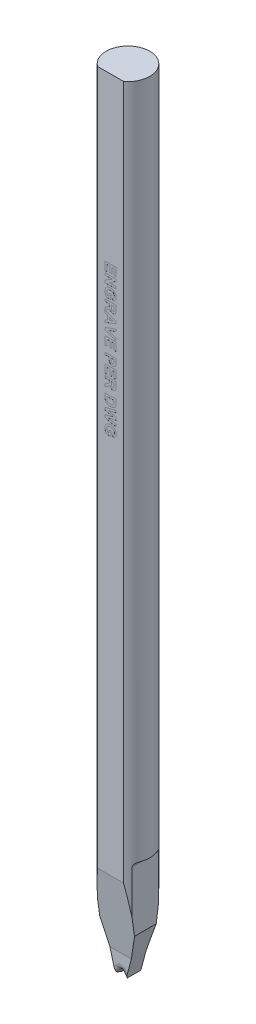
from build123d import *

# Parameters (mm, degrees)
SKETCH_TL_CUTTING_R       = 1.99771
TL_CUTTING_DEPTH          = 72.009
SKETCH_TDF_GRINDING_W     = 4.01542
SKETCH_TDF_GRINDING_H     = 4.01542
TDF_GRINDING_DEPTH        = 73.064400167
ENGRAVING_DEPTH           = 0.005
VW_VR_GRINDING_DEPTH      = 2.00771
VW_VR_GRINDING_DEPTH_BACK = 2.00771
ISA_GRINDING_DEPTH        = 2.00771
ISA_GRINDING_DEPTH_BACK   = 2.00771
PRE_FRX_BRX_DEPTH         = 2.00771
PRE_FRX_BRX_DEPTH_BACK    = 2.00771
SKETCH_PRE_FRX_BRX_W      = 1.33334
SKETCH_PRE_FRX_BRX_H      = 1.80086
FR_EDM_R                  = 0.50038
BR_EDM_R                  = 0.24892
FA_BA_GRINDING_DEPTH      = 2.00771
FA_BA_GRINDING_DEPTH_BACK = 2.00771


with BuildPart() as part:
    # sketch_TL_cutting → TL_cutting (new body)
    with BuildSketch(Plane(origin=(0, 0, 0), x_dir=(1, 0, 0), z_dir=(0, 1, 0))):
        Circle(SKETCH_TL_CUTTING_R)
    extrude(amount=TL_CUTTING_DEPTH)

    # sketch_TDF_grinding → TDF_grinding (cut, through all)
    with BuildSketch(Plane(origin=(0, 0, 0), x_dir=(1, 0, 0), z_dir=(0, 1, 0))):
        with Locations((0, -3.60918)):
            Rectangle(SKETCH_TDF_GRINDING_W, SKETCH_TDF_GRINDING_H)
    extrude(amount=TDF_GRINDING_DEPTH, mode=Mode.SUBTRACT)

    # sketch_engraving → engraving (cut)
    # profile 1 of 13: a face of its own
    with BuildSketch(Plane.XY.offset(1.60147)):
        Polygon((-0.5, 56.906435897), (0.5, 56.906435897), (0.5, 56.162846154), (0.333333333, 56.162846154), (0.333333333, 56.714128205), (0.115384615, 56.714128205), (0.115384615, 56.201307692), (-0.051282051, 56.201307692), (-0.051282051, 56.714128205), (-0.333333333, 56.714128205), (-0.333333333, 56.150025641), (-0.5, 56.150025641), align=None)
    # profile 2 of 13: a face of its own
    with BuildSketch(Plane.XY.offset(1.60147)):
        Polygon((-0.5, 55.983358974), (0.5, 55.983358974), (0.5, 55.7824375), (-0.157451923, 55.380794872), (0.5, 55.380794872), (0.5, 55.188487179), (-0.5, 55.188487179), (-0.5, 55.39561859), (0.147035256, 55.791051282), (-0.5, 55.791051282), align=None)
    # profile 3 of 13: a face of its own
    with BuildSketch(Plane.XY.offset(1.60147)):
        with BuildLine():
            Line((-0.128205128, 54.534641026), (0.038461538, 54.534641026))
            Line((0.038461538, 54.534641026), (0.038461538, 54.09874359))
            Line((0.038461538, 54.09874359), (-0.36338141, 54.09874359))
            add(Edge.make_bspline(
                [(-0.36338141, 54.09874359), (-0.368321434, 54.104229605), (-0.378419843, 54.115444131), (-0.392661125, 54.133741895), (-0.406257259, 54.15388601), (-0.4194836, 54.1757547), (-0.432233696, 54.199393223), (-0.444685123, 54.224707295), (-0.45671611, 54.251743622), (-0.471787381, 54.289976941), (-0.488186169, 54.339191061), (-0.502445448, 54.399356306), (-0.511191227, 54.459997498), (-0.512277771, 54.500558306), (-0.512820513, 54.52081891)],
                knots=[0, 0, 0, 0, 0.581799769, 1.189316438, 1.825828404, 2.496525428, 3.203088405, 3.942228803, 4.719818701, 5.534979611, 7.181138583, 8.803804008, 10.403462225, 12, 12, 12, 12], degree=3))
            add(Edge.make_bspline(
                [(-0.512820513, 54.52081891), (-0.512629241, 54.533511396), (-0.512252188, 54.558532062), (-0.509233571, 54.595470349), (-0.504017902, 54.631187455), (-0.496780719, 54.665619967), (-0.487836372, 54.698870877), (-0.476607913, 54.730823396), (-0.463065488, 54.761443299), (-0.447986133, 54.790959812), (-0.430657849, 54.818812408), (-0.411724289, 54.845056254), (-0.390891397, 54.869436635), (-0.36853351, 54.892165448), (-0.344060025, 54.912814033), (-0.318106216, 54.931895872), (-0.290219674, 54.948954268), (-0.260879177, 54.96428079), (-0.230317098, 54.977910173), (-0.198781008, 54.989412477), (-0.166726875, 54.999496153), (-0.134042675, 55.007783938), (-0.10062201, 55.013870885), (-0.066619552, 55.01860276), (-0.031822841, 55.021144234), (-0.008417054, 55.021593556), (0.003405449, 55.021820513)],
                knots=[0, 0, 0, 0, 1.124897971, 2.217508473, 3.282174662, 4.322209414, 5.334422951, 6.332119154, 7.320662553, 8.300074908, 9.267468154, 10.225199689, 11.165658754, 12.107290334, 13.047749399, 14.00069605, 14.959944213, 15.942088746, 16.933021067, 17.923599838, 18.915715637, 19.910475908, 20.909926025, 21.925232038, 22.952013513, 24, 24, 24, 24], degree=3))
            add(Edge.make_bspline(
                [(0.003405449, 55.021820513), (0.016165747, 55.021636614), (0.041321811, 55.021274069), (0.078501182, 55.018144425), (0.114594914, 55.01329647), (0.149519517, 55.005901478), (0.183523729, 54.997048027), (0.216299841, 54.985703339), (0.248180515, 54.972749892), (0.278688999, 54.957465774), (0.308028284, 54.940583202), (0.335510174, 54.921399631), (0.361403632, 54.90058003), (0.385591047, 54.877937199), (0.407627145, 54.853098237), (0.428063784, 54.826572539), (0.447146094, 54.79837769), (0.457908016, 54.778200967), (0.463341346, 54.768014423)],
                knots=[0, 0, 0, 0, 1.105132952, 2.178694671, 3.229818344, 4.257558797, 5.269123684, 6.27148554, 7.259679084, 8.247804916, 9.224967877, 10.189258471, 11.147685264, 12.101072275, 13.055511435, 14.02039165, 15.000562851, 16, 16, 16, 16], degree=3))
            add(Edge.make_bspline(
                [(0.463341346, 54.768014423), (0.467347168, 54.759927072), (0.475455657, 54.743556849), (0.485329628, 54.717483756), (0.494054347, 54.690116179), (0.500719187, 54.661134703), (0.506115234, 54.630848224), (0.510216979, 54.599107147), (0.512307439, 54.565852939), (0.512647258, 54.543190515), (0.512820513, 54.531636218)],
                knots=[0, 0, 0, 0, 0.887950456, 1.797368171, 2.741221183, 3.713797788, 4.722103116, 5.768966405, 6.862521341, 8, 8, 8, 8], degree=3))
            add(Edge.make_bspline(
                [(0.512820513, 54.531636218), (0.512598613, 54.516738718), (0.512167059, 54.487765835), (0.508571106, 54.445525541), (0.502373597, 54.405771904), (0.493837942, 54.368449565), (0.482863355, 54.333638928), (0.469371425, 54.301399918), (0.453633675, 54.27153466), (0.435019378, 54.244475716), (0.414494937, 54.219673149), (0.392035387, 54.19719168), (0.367607461, 54.177022262), (0.341334074, 54.159151549), (0.313106625, 54.143720198), (0.283182558, 54.130452182), (0.251334696, 54.119531), (0.22921692, 54.114253034), (0.217948718, 54.111564103)],
                knots=[0, 0, 0, 0, 1.271135529, 2.472123572, 3.614091059, 4.701890498, 5.736279567, 6.724681829, 7.680621489, 8.611506429, 9.52200816, 10.424540711, 11.318996785, 12.221421405, 13.131851814, 14.060431888, 15.011860567, 16, 16, 16, 16], degree=3))
            Line((0.217948718, 54.111564103), (0.179487179, 54.303871795))
            add(Edge.make_bspline(
                [(0.179487179, 54.303871795), (0.185798707, 54.305774377), (0.198251232, 54.309528136), (0.216108293, 54.316834712), (0.232994438, 54.325152834), (0.248643132, 54.334979827), (0.263649233, 54.345417482), (0.277161531, 54.357687665), (0.290187329, 54.370594684), (0.301701762, 54.38508584), (0.312086782, 54.400524395), (0.321450083, 54.416745863), (0.329043783, 54.434114205), (0.335153652, 54.452386828), (0.340342569, 54.471474233), (0.343533767, 54.491625571), (0.345940549, 54.51261453), (0.346081986, 54.526954556), (0.346153846, 54.534240385)],
                knots=[0, 0, 0, 0, 1.027780279, 2.027791312, 3.006028774, 3.96000864, 4.908113241, 5.852721087, 6.802883308, 7.765918715, 8.733730415, 9.704005314, 10.683351261, 11.68471758, 12.707948499, 13.764514378, 14.864202456, 16, 16, 16, 16], degree=3))
            add(Edge.make_bspline(
                [(0.346153846, 54.534240385), (0.345859633, 54.545267741), (0.34528545, 54.566788568), (0.341538784, 54.598206107), (0.334873123, 54.627845672), (0.325679114, 54.65578477), (0.313877959, 54.682074621), (0.299029501, 54.706359968), (0.282012344, 54.729245501), (0.262039987, 54.750079978), (0.239645267, 54.768974481), (0.214561065, 54.785331053), (0.186868462, 54.79894783), (0.156706511, 54.810100746), (0.124073954, 54.818980847), (0.088855272, 54.825004995), (0.051104495, 54.828941063), (0.02505068, 54.829318323), (0.01161859, 54.829512821)],
                knots=[0, 0, 0, 0, 1.043810997, 2.037086103, 2.989314757, 3.91471467, 4.817033861, 5.710208705, 6.603920097, 7.511448416, 8.435617211, 9.371747005, 10.338444094, 11.350425613, 12.411431869, 13.5347293, 14.729025275, 16, 16, 16, 16], degree=3))
            add(Edge.make_bspline(
                [(0.01161859, 54.829512821), (-0.002813331, 54.829310147), (-0.03086261, 54.828916238), (-0.071503034, 54.825081337), (-0.109371212, 54.818783116), (-0.14440027, 54.809715757), (-0.176807311, 54.798408494), (-0.206438048, 54.784428966), (-0.233109204, 54.76762113), (-0.256980675, 54.748558295), (-0.278169336, 54.727521484), (-0.296147735, 54.704458524), (-0.31184176, 54.680200317), (-0.32420794, 54.654060517), (-0.33413508, 54.626512028), (-0.341078682, 54.597285999), (-0.345395871, 54.566487729), (-0.345897627, 54.545406176), (-0.346153846, 54.534641026)],
                knots=[0, 0, 0, 0, 1.31821493, 2.562027667, 3.72541598, 4.821825939, 5.863743127, 6.857000185, 7.808227391, 8.737146514, 9.643023621, 10.529087527, 11.404035307, 12.277173472, 13.164790074, 14.074766194, 15.016892606, 16, 16, 16, 16], degree=3))
            add(Edge.make_bspline(
                [(-0.346153846, 54.534641026), (-0.345850315, 54.523737735), (-0.34524035, 54.501826847), (-0.340086045, 54.469005767), (-0.332449955, 54.436005514), (-0.321065283, 54.403613163), (-0.307937779, 54.372226456), (-0.292687307, 54.343060255), (-0.276962331, 54.315667677), (-0.264654274, 54.2991552), (-0.258613782, 54.291051282)],
                knots=[0, 0, 0, 0, 0.993779204, 1.997065276, 3.023588959, 4.078879359, 5.123947549, 6.123456565, 7.079038607, 8, 8, 8, 8], degree=3))
            Line((-0.258613782, 54.291051282), (-0.128205128, 54.291051282))
            Line((-0.128205128, 54.291051282), (-0.128205128, 54.534641026))
        make_face()
    # profile 4 of 13: a face of its own
    with BuildSketch(Plane.XY.offset(1.60147)):
        with BuildLine():
            Line((-0.5, 53.906435897), (0.5, 53.906435897))
            Line((0.5, 53.906435897), (0.5, 53.486764423))
            add(Edge.make_bspline(
                [(0.5, 53.486764423), (0.499921351, 53.474010201), (0.499769781, 53.449430481), (0.498665723, 53.413883268), (0.496349389, 53.381101265), (0.493735057, 53.350936822), (0.489890849, 53.323477094), (0.485377151, 53.298656079), (0.480042652, 53.276553829), (0.473762142, 53.2569266), (0.46640441, 53.239099938), (0.457825047, 53.222435326), (0.447696774, 53.206775272), (0.436444977, 53.191914477), (0.424039539, 53.177795254), (0.410155618, 53.164803274), (0.394999014, 53.152712567), (0.378696089, 53.141532781), (0.361318758, 53.131684096), (0.343425117, 53.122684982), (0.324824746, 53.115359364), (0.305605269, 53.10930847), (0.285808412, 53.104474923), (0.265383845, 53.101120032), (0.244368538, 53.099025611), (0.230173307, 53.098838641), (0.222956731, 53.09874359)],
                knots=[0, 0, 0, 0, 1.675792322, 3.229558513, 4.671612708, 5.993327294, 7.206773438, 8.313218507, 9.306927966, 10.191988363, 11.018030861, 11.838135071, 12.650980327, 13.465150207, 14.285535933, 15.117196726, 15.959844754, 16.83101188, 17.711363548, 18.582398133, 19.460517458, 20.334551361, 21.228266118, 22.135486512, 23.052118027, 24, 24, 24, 24], degree=3))
            add(Edge.make_bspline(
                [(0.222956731, 53.09874359), (0.213865176, 53.09891771), (0.196097772, 53.099257988), (0.170067915, 53.102459374), (0.145135532, 53.107060931), (0.121515047, 53.114174247), (0.099028777, 53.123018829), (0.077834712, 53.133824821), (0.057734109, 53.146577691), (0.039011166, 53.161343067), (0.021628172, 53.178061702), (0.005964946, 53.196827919), (-0.008142217, 53.217517705), (-0.020271369, 53.240300383), (-0.030960543, 53.264783224), (-0.039742833, 53.291288699), (-0.046961528, 53.31968005), (-0.050349413, 53.339434525), (-0.052083333, 53.349544872)],
                knots=[0, 0, 0, 0, 1.059179627, 2.069928931, 3.052909591, 4.01082991, 4.940120368, 5.865982481, 6.779263376, 7.710344595, 8.640547144, 9.585223395, 10.554458868, 11.553878165, 12.589111246, 13.664634927, 14.804759383, 16, 16, 16, 16], degree=3))
            add(Edge.make_bspline(
                [(-0.052083333, 53.349544872), (-0.058543192, 53.339754557), (-0.071157156, 53.320637315), (-0.092244136, 53.294340986), (-0.113935974, 53.270382324), (-0.13350323, 53.252395798), (-0.150629326, 53.238561316), (-0.165615492, 53.227428495), (-0.182859981, 53.215417912), (-0.202374991, 53.20264991), (-0.22398696, 53.188746224), (-0.248026974, 53.174224206), (-0.274260457, 53.158779885), (-0.292585876, 53.148396031), (-0.302083333, 53.143014423)],
                knots=[0, 0, 0, 0, 1.285482994, 2.510122655, 3.691653098, 4.826411195, 5.419869803, 6.105175889, 6.872935239, 7.723789235, 8.662129684, 9.690525463, 10.803075916, 12, 12, 12, 12], degree=3))
            Line((-0.302083333, 53.143014423), (-0.5, 53.021820513))
            Line((-0.5, 53.021820513), (-0.5, 53.246580128))
            Line((-0.5, 53.246580128), (-0.273036859, 53.388807692))
            add(Edge.make_bspline(
                [(-0.273036859, 53.388807692), (-0.263945443, 53.395337401), (-0.24658806, 53.407803957), (-0.221949287, 53.42583509), (-0.199893124, 53.442236608), (-0.1805544, 53.457027372), (-0.163731826, 53.470027709), (-0.149845803, 53.481682343), (-0.138230202, 53.491419639), (-0.126725879, 53.502454127), (-0.114887633, 53.515280533), (-0.103494307, 53.531142305), (-0.094238036, 53.547323543), (-0.087286311, 53.56482809), (-0.082478883, 53.585119627), (-0.079343719, 53.609479092), (-0.077067211, 53.638632144), (-0.076973557, 53.659702303), (-0.076923077, 53.671059295)],
                knots=[0, 0, 0, 0, 1.465382114, 2.797715724, 3.99708711, 5.063614826, 5.985194575, 6.779875669, 7.43696127, 7.968700361, 8.866038685, 9.717629234, 10.520014012, 11.30082289, 12.174340694, 13.242479345, 14.513673363, 16, 16, 16, 16], degree=3))
            Line((-0.076923077, 53.671059295), (-0.076923077, 53.714128205))
            Line((-0.076923077, 53.714128205), (-0.5, 53.714128205))
            Line((-0.5, 53.714128205), (-0.5, 53.906435897))
        make_face()
        with BuildLine():
            Line((0.08974359, 53.714128205), (0.08974359, 53.559280449))
            add(Edge.make_bspline(
                [(0.08974359, 53.559280449), (0.089768957, 53.5473274), (0.089817287, 53.524554821), (0.090527354, 53.492171991), (0.091115821, 53.463309113), (0.09265079, 53.438009153), (0.094114881, 53.416219334), (0.096069001, 53.397967128), (0.09836301, 53.383228848), (0.101931469, 53.368507986), (0.108148092, 53.353428202), (0.117003495, 53.337358518), (0.128487921, 53.323615466), (0.141777239, 53.311742986), (0.157332372, 53.302578485), (0.174706183, 53.295857484), (0.193862841, 53.291843774), (0.20724563, 53.291320802), (0.214142628, 53.291051282)],
                knots=[0, 0, 0, 0, 1.698120923, 3.235207303, 4.601799022, 5.7989489, 6.835765357, 7.704239165, 8.40605236, 8.953649664, 9.852072573, 10.714567413, 11.550246753, 12.383769498, 13.234656382, 14.099651817, 15.020630301, 16, 16, 16, 16], degree=3))
            add(Edge.make_bspline(
                [(0.214142628, 53.291051282), (0.221852989, 53.29138604), (0.236728888, 53.2920319), (0.257822961, 53.297286949), (0.27662771, 53.306034428), (0.292813882, 53.318523618), (0.306623576, 53.33412236), (0.317392842, 53.352846681), (0.325576055, 53.374291747), (0.328565774, 53.389745804), (0.330128205, 53.397822115)],
                knots=[0, 0, 0, 0, 1.062451802, 2.049829439, 2.976851779, 3.903462222, 4.849641532, 5.832195941, 6.867102576, 8, 8, 8, 8], degree=3))
            add(Edge.make_bspline(
                [(0.330128205, 53.397822115), (0.330421459, 53.400491011), (0.331116534, 53.406816853), (0.331562949, 53.417987541), (0.332249138, 53.432270698), (0.332529569, 53.449839208), (0.333021138, 53.470536115), (0.333111403, 53.494443719), (0.333399792, 53.521486063), (0.333356297, 53.540583752), (0.333333333, 53.550666667)],
                knots=[0, 0, 0, 0, 0.42127143, 0.998501726, 1.753681744, 2.66564073, 3.755712164, 5.002818897, 6.417592707, 8, 8, 8, 8], degree=3))
            Line((0.333333333, 53.550666667), (0.333333333, 53.714128205))
            Line((0.333333333, 53.714128205), (0.08974359, 53.714128205))
        make_face(mode=Mode.SUBTRACT)
    # profile 5 of 13: a face of its own
    with BuildSketch(Plane.XY.offset(1.60147)):
        Polygon((-0.5, 52.047461538), (-0.5, 52.251387821), (-0.269230769, 52.335722756), (-0.269230769, 52.719536859), (-0.5, 52.803871795), (-0.5, 53.009), (0.5, 52.630995192), (0.5, 52.427269231), align=None)
        Polygon((-0.102564103, 52.396820513), (0.256410256, 52.528230769), (-0.102564103, 52.659240385), align=None, mode=Mode.SUBTRACT)
    # profile 6 of 13: a face of its own
    with BuildSketch(Plane.XY.offset(1.60147)):
        Polygon((-0.5, 51.639208333), (0.5, 52.009), (0.5, 51.805875), (-0.243589744, 51.541051282), (0.5, 51.277229167), (0.5, 51.073102564), (-0.5, 51.441491987), align=None)
    # profile 7 of 13: a face of its own
    with BuildSketch(Plane.XY.offset(1.60147)):
        Polygon((-0.5, 50.983358974), (0.5, 50.983358974), (0.5, 50.239769231), (0.333333333, 50.239769231), (0.333333333, 50.791051282), (0.115384615, 50.791051282), (0.115384615, 50.278230769), (-0.051282051, 50.278230769), (-0.051282051, 50.791051282), (-0.333333333, 50.791051282), (-0.333333333, 50.226948718), (-0.5, 50.226948718), align=None)
    # profile 8 of 13: a face of its own
    with BuildSketch(Plane.XY.offset(1.60147)):
        with BuildLine():
            Line((-0.5, 49.675666667), (0.5, 49.675666667))
            Line((0.5, 49.675666667), (0.5, 49.355754808))
            add(Edge.make_bspline(
                [(0.5, 49.355754808), (0.4999852, 49.341264455), (0.499956962, 49.313616693), (0.499104777, 49.274084062), (0.497929464, 49.238489855), (0.496434625, 49.206822803), (0.494248137, 49.179166334), (0.491629455, 49.155458956), (0.488933209, 49.135591744), (0.486060508, 49.123834128), (0.484775641, 49.118575321)],
                knots=[0, 0, 0, 0, 1.460492613, 2.786636817, 3.985312262, 5.05006335, 5.98179196, 6.7807735, 7.454678796, 8, 8, 8, 8], degree=3))
            add(Edge.make_bspline(
                [(0.484775641, 49.118575321), (0.482781564, 49.111581959), (0.478823789, 49.097701776), (0.470386441, 49.077815803), (0.460608006, 49.05864887), (0.448953875, 49.040441805), (0.435630967, 49.023132663), (0.420747869, 49.006670188), (0.404237636, 48.990965844), (0.386131953, 48.976239765), (0.366525691, 48.962743742), (0.345376234, 48.951112401), (0.322847402, 48.941251925), (0.298873329, 48.933327517), (0.273610941, 48.926775617), (0.246834559, 48.922593024), (0.218752408, 48.919569504), (0.199528035, 48.9193623), (0.189703526, 48.91925641)],
                knots=[0, 0, 0, 0, 0.907183394, 1.800546498, 2.691728384, 3.591410291, 4.495216108, 5.416087871, 6.359626967, 7.337496937, 8.327236581, 9.327316132, 10.346534403, 11.393207653, 12.477041209, 13.600953845, 14.773980723, 16, 16, 16, 16], degree=3))
            add(Edge.make_bspline(
                [(0.189703526, 48.91925641), (0.174784734, 48.919564918), (0.146065241, 48.920158813), (0.104894137, 48.926808263), (0.067280604, 48.936941168), (0.03361575, 48.951782122), (0.003633111, 48.969795209), (-0.023091697, 48.989963014), (-0.046492635, 49.012446245), (-0.066210989, 49.037025478), (-0.082434, 49.062956803), (-0.096247437, 49.088955341), (-0.106871469, 49.115346515), (-0.11149992, 49.13334078), (-0.113782051, 49.142213141)],
                knots=[0, 0, 0, 0, 1.312446177, 2.526530956, 3.662051072, 4.733637382, 5.754065268, 6.735959421, 7.675686778, 8.604015004, 9.502732733, 10.365317746, 11.193993632, 12, 12, 12, 12], degree=3))
            add(Edge.make_bspline(
                [(-0.113782051, 49.142213141), (-0.114986663, 49.148545752), (-0.11752584, 49.161894139), (-0.120056937, 49.183063883), (-0.122858586, 49.206203561), (-0.124685978, 49.231408347), (-0.126397255, 49.25864775), (-0.127205205, 49.287911194), (-0.128178621, 49.319156857), (-0.128196112, 49.340663031), (-0.128205128, 49.351748397)],
                knots=[0, 0, 0, 0, 0.735353946, 1.55003838, 2.431865514, 3.394945452, 4.432993119, 5.54609699, 6.735134699, 8, 8, 8, 8], degree=3))
            Line((-0.128205128, 49.351748397), (-0.128205128, 49.483358974))
            Line((-0.128205128, 49.483358974), (-0.5, 49.483358974))
            Line((-0.5, 49.483358974), (-0.5, 49.675666667))
        make_face()
        with BuildLine():
            Line((0.333333333, 49.483358974), (0.038461538, 49.483358974))
            Line((0.038461538, 49.483358974), (0.038461538, 49.367974359))
            add(Edge.make_bspline(
                [(0.038461538, 49.367974359), (0.038474423, 49.358024233), (0.038499073, 49.33898839), (0.039383856, 49.311676178), (0.040463899, 49.286953138), (0.04225159, 49.264767611), (0.044607724, 49.245253517), (0.047425958, 49.228280173), (0.050450217, 49.213827797), (0.055461898, 49.19819952), (0.063570342, 49.181489767), (0.075224213, 49.163645715), (0.089157789, 49.147969737), (0.105522293, 49.134925245), (0.123704204, 49.124505583), (0.143517189, 49.117045099), (0.164632877, 49.11222787), (0.179260262, 49.111787861), (0.186698718, 49.111564103)],
                knots=[0, 0, 0, 0, 1.411705958, 2.700771114, 3.876961699, 4.922619712, 5.858038221, 6.66485904, 7.363650596, 7.950905807, 8.989198271, 9.987739806, 10.967313358, 11.951275539, 12.944273208, 13.927870418, 14.946261014, 16, 16, 16, 16], degree=3))
            add(Edge.make_bspline(
                [(0.186698718, 49.111564103), (0.195758642, 49.111879017), (0.213324639, 49.112489596), (0.238341551, 49.11922257), (0.261044702, 49.129610781), (0.280727694, 49.144462972), (0.297279472, 49.16240407), (0.31105114, 49.182569116), (0.320688658, 49.205388742), (0.32442284, 49.221538921), (0.326322115, 49.229753205)],
                knots=[0, 0, 0, 0, 1.085904563, 2.105425768, 3.088705091, 4.068969419, 5.045188284, 6.010769642, 6.988240112, 8, 8, 8, 8], degree=3))
            add(Edge.make_bspline(
                [(0.326322115, 49.229753205), (0.326887477, 49.233287999), (0.328142404, 49.241134146), (0.329452077, 49.254176039), (0.330643223, 49.269604601), (0.331621189, 49.287438428), (0.332385732, 49.307606833), (0.333055661, 49.33017634), (0.333109481, 49.355087507), (0.333256648, 49.37251512), (0.333333333, 49.381596154)],
                knots=[0, 0, 0, 0, 0.564603001, 1.253243608, 2.066786758, 3.005752288, 4.070476343, 5.250658742, 6.567396469, 8, 8, 8, 8], degree=3))
            Line((0.333333333, 49.381596154), (0.333333333, 49.483358974))
        make_face(mode=Mode.SUBTRACT)
    # profile 9 of 13: a face of its own
    with BuildSketch(Plane.XY.offset(1.60147)):
        Polygon((-0.5, 48.752589744), (0.5, 48.752589744), (0.5, 48.009), (0.333333333, 48.009), (0.333333333, 48.560282051), (0.115384615, 48.560282051), (0.115384615, 48.047461538), (-0.051282051, 48.047461538), (-0.051282051, 48.560282051), (-0.333333333, 48.560282051), (-0.333333333, 47.996179487), (-0.5, 47.996179487), align=None)
    # profile 10 of 13: a face of its own
    with BuildSketch(Plane.XY.offset(1.60147)):
        with BuildLine():
            Line((-0.5, 47.829512821), (0.5, 47.829512821))
            Line((0.5, 47.829512821), (0.5, 47.409841346))
            add(Edge.make_bspline(
                [(0.5, 47.409841346), (0.499921351, 47.397087124), (0.499769781, 47.372507404), (0.498665723, 47.336960191), (0.496349389, 47.304178188), (0.493735057, 47.274013745), (0.489890849, 47.246554017), (0.485377151, 47.221733002), (0.480042652, 47.199630752), (0.473762142, 47.180003523), (0.46640441, 47.162176861), (0.457825047, 47.145512249), (0.447696774, 47.129852195), (0.436444977, 47.1149914), (0.424039539, 47.100872178), (0.410155618, 47.087880198), (0.394999014, 47.07578949), (0.378696089, 47.064609704), (0.361318758, 47.054761019), (0.343425117, 47.045761905), (0.324824746, 47.038436287), (0.305605269, 47.032385393), (0.285808412, 47.027551846), (0.265383845, 47.024196956), (0.244368538, 47.022102534), (0.230173307, 47.021915564), (0.222956731, 47.021820513)],
                knots=[0, 0, 0, 0, 1.675792322, 3.229558513, 4.671612708, 5.993327294, 7.206773438, 8.313218507, 9.306927966, 10.191988363, 11.018030861, 11.838135071, 12.650980327, 13.465150207, 14.285535933, 15.117196726, 15.959844754, 16.83101188, 17.711363548, 18.582398133, 19.460517458, 20.334551361, 21.228266118, 22.135486512, 23.052118027, 24, 24, 24, 24], degree=3))
            add(Edge.make_bspline(
                [(0.222956731, 47.021820513), (0.213865176, 47.021994633), (0.196097772, 47.022334911), (0.170067915, 47.025536297), (0.145135532, 47.030137854), (0.121515047, 47.03725117), (0.099028777, 47.046095752), (0.077834712, 47.056901744), (0.057734109, 47.069654614), (0.039011166, 47.08441999), (0.021628172, 47.101138625), (0.005964946, 47.119904843), (-0.008142217, 47.140594628), (-0.020271369, 47.163377306), (-0.030960543, 47.187860147), (-0.039742833, 47.214365622), (-0.046961528, 47.242756973), (-0.050349413, 47.262511448), (-0.052083333, 47.272621795)],
                knots=[0, 0, 0, 0, 1.059179627, 2.069928931, 3.052909591, 4.01082991, 4.940120368, 5.865982481, 6.779263376, 7.710344595, 8.640547144, 9.585223395, 10.554458868, 11.553878165, 12.589111246, 13.664634927, 14.804759383, 16, 16, 16, 16], degree=3))
            add(Edge.make_bspline(
                [(-0.052083333, 47.272621795), (-0.058543192, 47.26283148), (-0.071157156, 47.243714238), (-0.092244136, 47.217417909), (-0.113935974, 47.193459247), (-0.13350323, 47.175472722), (-0.150629326, 47.161638239), (-0.165615492, 47.150505418), (-0.182859981, 47.138494835), (-0.202374991, 47.125726833), (-0.22398696, 47.111823147), (-0.248026974, 47.097301129), (-0.274260457, 47.081856808), (-0.292585876, 47.071472954), (-0.302083333, 47.066091346)],
                knots=[0, 0, 0, 0, 1.285482994, 2.510122655, 3.691653098, 4.826411195, 5.419869803, 6.105175889, 6.872935239, 7.723789235, 8.662129684, 9.690525463, 10.803075916, 12, 12, 12, 12], degree=3))
            Line((-0.302083333, 47.066091346), (-0.5, 46.944897436))
            Line((-0.5, 46.944897436), (-0.5, 47.169657051))
            Line((-0.5, 47.169657051), (-0.273036859, 47.311884615))
            add(Edge.make_bspline(
                [(-0.273036859, 47.311884615), (-0.263945443, 47.318414324), (-0.24658806, 47.33088088), (-0.221949287, 47.348912013), (-0.199893124, 47.365313531), (-0.1805544, 47.380104295), (-0.163731826, 47.393104632), (-0.149845803, 47.404759266), (-0.138230202, 47.414496562), (-0.126725879, 47.42553105), (-0.114887633, 47.438357456), (-0.103494307, 47.454219228), (-0.094238036, 47.470400466), (-0.087286311, 47.487905013), (-0.082478883, 47.508196551), (-0.079343719, 47.532556015), (-0.077067211, 47.561709067), (-0.076973557, 47.582779226), (-0.076923077, 47.594136218)],
                knots=[0, 0, 0, 0, 1.465382114, 2.797715724, 3.99708711, 5.063614826, 5.985194575, 6.779875669, 7.43696127, 7.968700361, 8.866038685, 9.717629234, 10.520014012, 11.30082289, 12.174340694, 13.242479345, 14.513673363, 16, 16, 16, 16], degree=3))
            Line((-0.076923077, 47.594136218), (-0.076923077, 47.637205128))
            Line((-0.076923077, 47.637205128), (-0.5, 47.637205128))
            Line((-0.5, 47.637205128), (-0.5, 47.829512821))
        make_face()
        with BuildLine():
            Line((0.08974359, 47.637205128), (0.08974359, 47.482357372))
            add(Edge.make_bspline(
                [(0.08974359, 47.482357372), (0.089768957, 47.470404323), (0.089817287, 47.447631744), (0.090527354, 47.415248914), (0.091115821, 47.386386036), (0.09265079, 47.361086076), (0.094114881, 47.339296257), (0.096069001, 47.321044051), (0.09836301, 47.306305771), (0.101931469, 47.291584909), (0.108148092, 47.276505125), (0.117003495, 47.260435441), (0.128487921, 47.246692389), (0.141777239, 47.234819909), (0.157332372, 47.225655408), (0.174706183, 47.218934407), (0.193862841, 47.214920697), (0.20724563, 47.214397726), (0.214142628, 47.214128205)],
                knots=[0, 0, 0, 0, 1.698120923, 3.235207303, 4.601799022, 5.7989489, 6.835765357, 7.704239165, 8.40605236, 8.953649664, 9.852072573, 10.714567413, 11.550246753, 12.383769498, 13.234656382, 14.099651817, 15.020630301, 16, 16, 16, 16], degree=3))
            add(Edge.make_bspline(
                [(0.214142628, 47.214128205), (0.221852989, 47.214462963), (0.236728888, 47.215108823), (0.257822961, 47.220363872), (0.27662771, 47.229111351), (0.292813882, 47.241600541), (0.306623576, 47.257199283), (0.317392842, 47.275923604), (0.325576055, 47.29736867), (0.328565774, 47.312822727), (0.330128205, 47.320899038)],
                knots=[0, 0, 0, 0, 1.062451802, 2.049829439, 2.976851779, 3.903462222, 4.849641532, 5.832195941, 6.867102576, 8, 8, 8, 8], degree=3))
            add(Edge.make_bspline(
                [(0.330128205, 47.320899038), (0.330421459, 47.323567934), (0.331116534, 47.329893776), (0.331562949, 47.341064464), (0.332249138, 47.355347621), (0.332529569, 47.372916131), (0.333021138, 47.393613038), (0.333111403, 47.417520642), (0.333399792, 47.444562986), (0.333356297, 47.463660675), (0.333333333, 47.47374359)],
                knots=[0, 0, 0, 0, 0.42127143, 0.998501726, 1.753681744, 2.66564073, 3.755712164, 5.002818897, 6.417592707, 8, 8, 8, 8], degree=3))
            Line((0.333333333, 47.47374359), (0.333333333, 47.637205128))
            Line((0.333333333, 47.637205128), (0.08974359, 47.637205128))
        make_face(mode=Mode.SUBTRACT)
    # profile 11 of 13: a face of its own
    with BuildSketch(Plane.XY.offset(1.60147)):
        with BuildLine():
            Line((0.5, 46.444897436), (0.5, 46.078110577))
            add(Edge.make_bspline(
                [(0.5, 46.078110577), (0.500005193, 46.068093032), (0.500015306, 46.048586546), (0.498840892, 46.020277527), (0.497659587, 45.993804956), (0.495294873, 45.969244813), (0.492816233, 45.946511894), (0.489678088, 45.925565404), (0.485656212, 45.906537663), (0.482484481, 45.894538781), (0.480969551, 45.888807692)],
                knots=[0, 0, 0, 0, 1.259756885, 2.453039283, 3.563158368, 4.591894114, 5.55549294, 6.43918076, 7.254497783, 8, 8, 8, 8], degree=3))
            add(Edge.make_bspline(
                [(0.480969551, 45.888807692), (0.478637325, 45.881638716), (0.474014881, 45.867429893), (0.465827813, 45.84657684), (0.455960096, 45.826742941), (0.445111978, 45.80746828), (0.432903728, 45.789196015), (0.419595761, 45.771481335), (0.404753223, 45.754848264), (0.383633179, 45.733313601), (0.35420815, 45.708888717), (0.315375005, 45.683058181), (0.272594656, 45.661320476), (0.234409605, 45.646129103), (0.20183843, 45.636085004), (0.175754603, 45.629516602), (0.148301213, 45.623844929), (0.119383738, 45.619594754), (0.08913491, 45.615933367), (0.057465542, 45.613305699), (0.024383276, 45.612004712), (0.001870575, 45.611712956), (-0.009615385, 45.611564103)],
                knots=[0, 0, 0, 0, 0.745431882, 1.477436776, 2.212739876, 2.934276521, 3.663147754, 4.384200836, 5.123377481, 5.865761747, 7.365547505, 8.894711587, 10.468722596, 12.101948761, 12.951987285, 13.837595333, 14.760899389, 15.722756883, 16.726861385, 17.773652936, 18.864119771, 20, 20, 20, 20], degree=3))
            add(Edge.make_bspline(
                [(-0.009615385, 45.611564103), (-0.0294616, 45.611955507), (-0.067834928, 45.612712302), (-0.123301552, 45.618309673), (-0.17465514, 45.62760511), (-0.206804138, 45.637315536), (-0.222355769, 45.642012821)],
                knots=[0, 0, 0, 0, 1.103491527, 2.133638164, 3.0971734, 4, 4, 4, 4], degree=3))
            add(Edge.make_bspline(
                [(-0.222355769, 45.642012821), (-0.231274521, 45.645186465), (-0.248819098, 45.651429518), (-0.274127236, 45.662354394), (-0.298211673, 45.674158799), (-0.321053432, 45.686940646), (-0.342549771, 45.700764513), (-0.362636394, 45.715682107), (-0.381577746, 45.731462192), (-0.393236239, 45.742893951), (-0.399038462, 45.748583333)],
                knots=[0, 0, 0, 0, 1.090884612, 2.145940218, 3.175104604, 4.181306866, 5.161203701, 6.118658341, 7.063689906, 8, 8, 8, 8], degree=3))
            add(Edge.make_bspline(
                [(-0.399038462, 45.748583333), (-0.407300305, 45.757869607), (-0.424264154, 45.776936893), (-0.445652736, 45.810288411), (-0.464086504, 45.848163738), (-0.473760833, 45.875477629), (-0.478766026, 45.889608974)],
                knots=[0, 0, 0, 0, 0.912008655, 1.872605891, 2.89935344, 4, 4, 4, 4], degree=3))
            add(Edge.make_bspline(
                [(-0.478766026, 45.889608974), (-0.4805228, 45.895328948), (-0.484168894, 45.907200457), (-0.488062998, 45.926023906), (-0.492165475, 45.946118409), (-0.49463687, 45.967715685), (-0.497243066, 45.990591543), (-0.498706299, 46.014928283), (-0.49974511, 46.040641542), (-0.499913777, 46.058277636), (-0.5, 46.067293269)],
                knots=[0, 0, 0, 0, 0.799129865, 1.658552685, 2.566799617, 3.538529252, 4.561352959, 5.643373779, 6.795284424, 8, 8, 8, 8], degree=3))
            Line((-0.5, 46.067293269), (-0.5, 46.444897436))
            Line((-0.5, 46.444897436), (0.5, 46.444897436))
        make_face()
        with BuildLine():
            Line((0.333333333, 46.252589744), (-0.333333333, 46.252589744))
            Line((-0.333333333, 46.252589744), (-0.333333333, 46.094336538))
            add(Edge.make_bspline(
                [(-0.333333333, 46.094336538), (-0.333276671, 46.087191821), (-0.333167574, 46.073435511), (-0.332847006, 46.053529778), (-0.331979167, 46.035236576), (-0.331080228, 46.018460076), (-0.329595022, 46.003243952), (-0.328134266, 45.989521997), (-0.326090699, 45.977370593), (-0.324477534, 45.969865588), (-0.323717949, 45.966331731)],
                knots=[0, 0, 0, 0, 1.333384787, 2.567275092, 3.714769766, 4.750907381, 5.701951617, 6.567520054, 7.325492842, 8, 8, 8, 8], degree=3))
            add(Edge.make_bspline(
                [(-0.323717949, 45.966331731), (-0.321509316, 45.958055036), (-0.317207482, 45.941934219), (-0.307617456, 45.919298961), (-0.296048139, 45.898816969), (-0.282136533, 45.880145232), (-0.26455548, 45.863318131), (-0.242070693, 45.848954145), (-0.215254411, 45.835660653), (-0.189584523, 45.826557267), (-0.16665678, 45.820022874), (-0.147412959, 45.815599626), (-0.126593091, 45.812104053), (-0.104279343, 45.809097404), (-0.080500412, 45.80666796), (-0.055170426, 45.805156245), (-0.028320392, 45.80412449), (-0.009883527, 45.803957622), (-0.000400641, 45.803871795)],
                knots=[0, 0, 0, 0, 1.038686998, 2.023088296, 2.974059649, 3.888265163, 4.839857954, 5.909819677, 7.113156087, 8.466843969, 9.20827164, 10.006482943, 10.861893492, 11.769681931, 12.739021491, 13.762258324, 14.849031541, 16, 16, 16, 16], degree=3))
            add(Edge.make_bspline(
                [(-0.000400641, 45.803871795), (0.009082275, 45.803956962), (0.027452469, 45.804121946), (0.054102292, 45.805152126), (0.079033415, 45.806655325), (0.102276578, 45.809102152), (0.123864169, 45.812061918), (0.143813574, 45.815599353), (0.161996804, 45.819992884), (0.183589283, 45.826545973), (0.207947697, 45.836383458), (0.23429421, 45.850209661), (0.2571147, 45.866474863), (0.276689574, 45.884830019), (0.29287817, 45.905917031), (0.306422028, 45.929287832), (0.316938162, 45.955418741), (0.321416742, 45.974007779), (0.323717949, 45.983559295)],
                knots=[0, 0, 0, 0, 1.118059345, 2.165891593, 3.144157881, 4.062285166, 4.920717571, 5.712910489, 6.449981617, 7.12489426, 8.371943983, 9.541298068, 10.624898781, 11.666293176, 12.69306237, 13.747704633, 14.842713931, 16, 16, 16, 16], degree=3))
            add(Edge.make_bspline(
                [(0.323717949, 45.983559295), (0.324486218, 45.987693605), (0.326177652, 45.996795773), (0.328151987, 46.011900032), (0.329628909, 46.02968664), (0.331099472, 46.050115577), (0.331977905, 46.073165526), (0.332859431, 46.098871032), (0.333166326, 46.127255313), (0.333276065, 46.147087669), (0.333333333, 46.1574375)],
                knots=[0, 0, 0, 0, 0.578739524, 1.274162912, 2.095457587, 3.035141998, 4.093102578, 5.270121571, 6.575369351, 8, 8, 8, 8], degree=3))
            Line((0.333333333, 46.1574375), (0.333333333, 46.252589744))
        make_face(mode=Mode.SUBTRACT)
    # profile 12 of 13: a face of its own
    with BuildSketch(Plane.XY.offset(1.60147)):
        Polygon((-0.5, 45.308078526), (0.5, 45.547461538), (0.5, 45.350346154), (-0.186899038, 45.194897436), (0.5, 45.030434295), (0.5, 44.768014423), (-0.198517628, 44.605153846), (0.5, 44.450105769), (0.5, 44.252589744), (-0.5, 44.487565705), (-0.5, 44.725746795), (0.247596154, 44.900025641), (-0.5, 45.078911859), align=None)
    # profile 13 of 13: a face of its own
    with BuildSketch(Plane.XY.offset(1.60147)):
        with BuildLine():
            Line((-0.128205128, 43.688487179), (0.038461538, 43.688487179))
            Line((0.038461538, 43.688487179), (0.038461538, 43.252589744))
            Line((0.038461538, 43.252589744), (-0.36338141, 43.252589744))
            add(Edge.make_bspline(
                [(-0.36338141, 43.252589744), (-0.368321434, 43.258075759), (-0.378419843, 43.269290285), (-0.392661125, 43.287588049), (-0.406257259, 43.307732164), (-0.4194836, 43.329600854), (-0.432233696, 43.353239376), (-0.444685123, 43.378553449), (-0.45671611, 43.405589776), (-0.471787381, 43.443823095), (-0.488186169, 43.493037215), (-0.502445448, 43.55320246), (-0.511191227, 43.613843651), (-0.512277771, 43.65440446), (-0.512820513, 43.674665064)],
                knots=[0, 0, 0, 0, 0.581799769, 1.189316438, 1.825828404, 2.496525428, 3.203088405, 3.942228803, 4.719818701, 5.534979611, 7.181138583, 8.803804008, 10.403462225, 12, 12, 12, 12], degree=3))
            add(Edge.make_bspline(
                [(-0.512820513, 43.674665064), (-0.512629241, 43.68735755), (-0.512252188, 43.712378215), (-0.509233571, 43.749316503), (-0.504017902, 43.785033609), (-0.496780719, 43.819466121), (-0.487836372, 43.85271703), (-0.476607913, 43.88466955), (-0.463065488, 43.915289453), (-0.447986133, 43.944805966), (-0.430657849, 43.972658562), (-0.411724289, 43.998902408), (-0.390891397, 44.023282789), (-0.36853351, 44.046011601), (-0.344060025, 44.066660187), (-0.318106216, 44.085742026), (-0.290219674, 44.102800422), (-0.260879177, 44.118126944), (-0.230317098, 44.131756327), (-0.198781008, 44.14325863), (-0.166726875, 44.153342307), (-0.134042675, 44.161630092), (-0.10062201, 44.167717039), (-0.066619552, 44.172448914), (-0.031822841, 44.174990388), (-0.008417054, 44.17543971), (0.003405449, 44.175666667)],
                knots=[0, 0, 0, 0, 1.124897971, 2.217508473, 3.282174662, 4.322209414, 5.334422951, 6.332119154, 7.320662553, 8.300074908, 9.267468154, 10.225199689, 11.165658754, 12.107290334, 13.047749399, 14.00069605, 14.959944213, 15.942088746, 16.933021067, 17.923599838, 18.915715637, 19.910475908, 20.909926025, 21.925232038, 22.952013513, 24, 24, 24, 24], degree=3))
            add(Edge.make_bspline(
                [(0.003405449, 44.175666667), (0.016165747, 44.175482768), (0.041321811, 44.175120223), (0.078501182, 44.171990579), (0.114594914, 44.167142624), (0.149519517, 44.159747632), (0.183523729, 44.15089418), (0.216299841, 44.139549493), (0.248180515, 44.126596046), (0.278688999, 44.111311928), (0.308028284, 44.094429356), (0.335510174, 44.075245784), (0.361403632, 44.054426184), (0.385591047, 44.031783353), (0.407627145, 44.006944391), (0.428063784, 43.980418692), (0.447146094, 43.952223844), (0.457908016, 43.932047121), (0.463341346, 43.921860577)],
                knots=[0, 0, 0, 0, 1.105132952, 2.178694671, 3.229818344, 4.257558797, 5.269123684, 6.27148554, 7.259679084, 8.247804916, 9.224967877, 10.189258471, 11.147685264, 12.101072275, 13.055511435, 14.02039165, 15.000562851, 16, 16, 16, 16], degree=3))
            add(Edge.make_bspline(
                [(0.463341346, 43.921860577), (0.467347168, 43.913773226), (0.475455657, 43.897403002), (0.485329628, 43.871329909), (0.494054347, 43.843962333), (0.500719187, 43.814980857), (0.506115234, 43.784694378), (0.510216979, 43.752953301), (0.512307439, 43.719699093), (0.512647258, 43.697036668), (0.512820513, 43.685482372)],
                knots=[0, 0, 0, 0, 0.887950456, 1.797368171, 2.741221183, 3.713797788, 4.722103116, 5.768966405, 6.862521341, 8, 8, 8, 8], degree=3))
            add(Edge.make_bspline(
                [(0.512820513, 43.685482372), (0.512598613, 43.670584872), (0.512167059, 43.641611989), (0.508571106, 43.599371695), (0.502373597, 43.559618058), (0.493837942, 43.522295719), (0.482863355, 43.487485082), (0.469371425, 43.455246072), (0.453633675, 43.425380814), (0.435019378, 43.398321869), (0.414494937, 43.373519302), (0.392035387, 43.351037834), (0.367607461, 43.330868415), (0.341334074, 43.312997703), (0.313106625, 43.297566351), (0.283182558, 43.284298336), (0.251334696, 43.273377154), (0.22921692, 43.268099188), (0.217948718, 43.265410256)],
                knots=[0, 0, 0, 0, 1.271135529, 2.472123572, 3.614091059, 4.701890498, 5.736279567, 6.724681829, 7.680621489, 8.611506429, 9.52200816, 10.424540711, 11.318996785, 12.221421405, 13.131851814, 14.060431888, 15.011860567, 16, 16, 16, 16], degree=3))
            Line((0.217948718, 43.265410256), (0.179487179, 43.457717949))
            add(Edge.make_bspline(
                [(0.179487179, 43.457717949), (0.185798707, 43.459620531), (0.198251232, 43.463374289), (0.216108293, 43.470680866), (0.232994438, 43.478998988), (0.248643132, 43.488825981), (0.263649233, 43.499263636), (0.277161531, 43.511533819), (0.290187329, 43.524440837), (0.301701762, 43.538931994), (0.312086782, 43.554370549), (0.321450083, 43.570592017), (0.329043783, 43.587960359), (0.335153652, 43.606232982), (0.340342569, 43.625320387), (0.343533767, 43.645471725), (0.345940549, 43.666460684), (0.346081986, 43.68080071), (0.346153846, 43.688086538)],
                knots=[0, 0, 0, 0, 1.027780279, 2.027791312, 3.006028774, 3.96000864, 4.908113241, 5.852721087, 6.802883308, 7.765918715, 8.733730415, 9.704005314, 10.683351261, 11.68471758, 12.707948499, 13.764514378, 14.864202456, 16, 16, 16, 16], degree=3))
            add(Edge.make_bspline(
                [(0.346153846, 43.688086538), (0.345859633, 43.699113895), (0.34528545, 43.720634722), (0.341538784, 43.752052261), (0.334873123, 43.781691826), (0.325679114, 43.809630924), (0.313877959, 43.835920775), (0.299029501, 43.860206122), (0.282012344, 43.883091655), (0.262039987, 43.903926131), (0.239645267, 43.922820635), (0.214561065, 43.939177207), (0.186868462, 43.952793984), (0.156706511, 43.9639469), (0.124073954, 43.972827), (0.088855272, 43.978851148), (0.051104495, 43.982787217), (0.02505068, 43.983164477), (0.01161859, 43.983358974)],
                knots=[0, 0, 0, 0, 1.043810997, 2.037086103, 2.989314757, 3.91471467, 4.817033861, 5.710208705, 6.603920097, 7.511448416, 8.435617211, 9.371747005, 10.338444094, 11.350425613, 12.411431869, 13.5347293, 14.729025275, 16, 16, 16, 16], degree=3))
            add(Edge.make_bspline(
                [(0.01161859, 43.983358974), (-0.002813331, 43.9831563), (-0.03086261, 43.982762392), (-0.071503034, 43.978927491), (-0.109371212, 43.972629269), (-0.14440027, 43.963561911), (-0.176807311, 43.952254648), (-0.206438048, 43.93827512), (-0.233109204, 43.921467284), (-0.256980675, 43.902404449), (-0.278169336, 43.881367638), (-0.296147735, 43.858304678), (-0.31184176, 43.83404647), (-0.32420794, 43.807906671), (-0.33413508, 43.780358182), (-0.341078682, 43.751132153), (-0.345395871, 43.720333883), (-0.345897627, 43.69925233), (-0.346153846, 43.688487179)],
                knots=[0, 0, 0, 0, 1.31821493, 2.562027667, 3.72541598, 4.821825939, 5.863743127, 6.857000185, 7.808227391, 8.737146514, 9.643023621, 10.529087527, 11.404035307, 12.277173472, 13.164790074, 14.074766194, 15.016892606, 16, 16, 16, 16], degree=3))
            add(Edge.make_bspline(
                [(-0.346153846, 43.688487179), (-0.345850315, 43.677583888), (-0.34524035, 43.655673001), (-0.340086045, 43.622851921), (-0.332449955, 43.589851668), (-0.321065283, 43.557459317), (-0.307937779, 43.52607261), (-0.292687307, 43.496906408), (-0.276962331, 43.469513831), (-0.264654274, 43.453001354), (-0.258613782, 43.444897436)],
                knots=[0, 0, 0, 0, 0.993779204, 1.997065276, 3.023588959, 4.078879359, 5.123947549, 6.123456565, 7.079038607, 8, 8, 8, 8], degree=3))
            Line((-0.258613782, 43.444897436), (-0.128205128, 43.444897436))
            Line((-0.128205128, 43.444897436), (-0.128205128, 43.688487179))
        make_face()
    extrude(amount=-ENGRAVING_DEPTH, mode=Mode.SUBTRACT)

    # sketch_VW_VR_grinding → VW_VR_grinding (cut, two sides: drawn at the far end of the back side and taken through both)
    with BuildSketch(Plane.XY.offset(-VW_VR_GRINDING_DEPTH_BACK)):
        with BuildLine():
            Line((-1.59004, -0.01), (-1.59004, 9.681972))
            ThreePointArc((-1.59004, 9.681972), (-1.683182387, 9.906837613), (-1.908048, 9.99998))
            Line((-1.908048, 9.99998), (-2.00771, 9.99998))
            Line((-2.00771, 9.99998), (-2.00771, -0.01))
            Line((-2.00771, -0.01), (-1.59004, -0.01))
        make_face()
        with BuildLine():
            Line((1.59004, -0.01), (1.59004, 9.681972))
            ThreePointArc((1.59004, 9.681972), (1.683182387, 9.906837613), (1.908048, 9.99998))
            Line((1.908048, 9.99998), (2.00771, 9.99998))
            Line((2.00771, 9.99998), (2.00771, -0.01))
            Line((2.00771, -0.01), (1.59004, -0.01))
        make_face()
    extrude(amount=VW_VR_GRINDING_DEPTH + VW_VR_GRINDING_DEPTH_BACK, mode=Mode.SUBTRACT)

    # sketch_ISA_grinding → ISA_grinding (cut, two sides: drawn at the far end of the back side and taken through both)
    with BuildSketch(Plane.XY.offset(-ISA_GRINDING_DEPTH_BACK)):
        Polygon((-0.50038, 0), (-2.00771, 5.625432144), (-2.00771, -0.01), (2.00771, -0.01), (2.00771, 5.625432144), (0.50038, 0), align=None)
    extrude(amount=ISA_GRINDING_DEPTH + ISA_GRINDING_DEPTH_BACK, mode=Mode.SUBTRACT)

    # sketch_pre_FRX_BRX → pre_FRX_BRX (cut, two sides: drawn at the far end of the back side and taken through both)
    with BuildSketch(Plane(origin=(0, 0, 0), x_dir=(0, 0, -1), z_dir=(1, 0, 0)).offset(-PRE_FRX_BRX_DEPTH_BACK)):
        with Locations((-1.34104, 0.89043)):
            Rectangle(SKETCH_PRE_FRX_BRX_W, SKETCH_PRE_FRX_BRX_H)
        with Locations((1.34104, 0.89043)):
            Rectangle(SKETCH_PRE_FRX_BRX_W, SKETCH_PRE_FRX_BRX_H)
    extrude(amount=PRE_FRX_BRX_DEPTH + PRE_FRX_BRX_DEPTH_BACK, mode=Mode.SUBTRACT)

    # V-Groove_EDM: sweep along a path in sketch_contour_V-Groove
    with BuildLine(Plane(origin=(0, 0, 0), x_dir=(0, 0, -1), z_dir=(1, 0, 0))) as v_groove_edm_path:
        Line((-1.60147, 0.3556), (0, 0.3556))
        Line((0, 0.3556), (1.99771, 0.3556))
    # sketch_section_V-Groove → V-Groove_EDM (sweep, cut)
    with BuildSketch(Plane.XY.offset(1.60147)):
        with BuildLine():
            Line((-2.765528006, -3.556), (-0.041851153, 0.333813669))
            ThreePointArc((-0.041851153, 0.333813669), (0, 0.3556), (0.041851153, 0.333813669))
            Line((0.041851153, 0.333813669), (2.765528006, -3.556))
            Line((2.765528006, -3.556), (-2.765528006, -3.556))
        make_face()
    sweep(path=v_groove_edm_path.line, mode=Mode.SUBTRACT)

    # FR_EDM
    fr_edm_edges = [part.edges().sort_by_distance(p)[0] for p in [
        (0.158720576, 0.166906834, 0.67437),
        (0, 0.3556, 0.67437),
        (-0.158720576, 0.166906834, 0.67437),
    ]]
    fillet(fr_edm_edges, radius=FR_EDM_R)

    # BR_EDM
    br_edm_edges = [part.edges().sort_by_distance(p)[0] for p in [
        (0.158720576, 0.166906834, -0.67437),
        (0, 0.3556, -0.67437),
        (-0.158720576, 0.166906834, -0.67437),
    ]]
    fillet(br_edm_edges, radius=BR_EDM_R)

    # sketch_FA_BA_grinding → FA_BA_grinding (cut, two sides: drawn at the far end of the back side and taken through both)
    with BuildSketch(Plane(origin=(0, 0, 0), x_dir=(0, 0, -1), z_dir=(1, 0, 0)).offset(-FA_BA_GRINDING_DEPTH_BACK)):
        Polygon((2.99771, 18.332283091), (2.99771, -0.1), (0.67437, -0.1), (0.67437, 1.80086), align=None)
        Polygon((-3.622078656, 22.774896919), (-0.67437, 1.80086), (-0.67437, -0.1), (-3.622078656, -0.1), align=None)
    extrude(amount=FA_BA_GRINDING_DEPTH + FA_BA_GRINDING_DEPTH_BACK, mode=Mode.SUBTRACT)


solid = part.part
